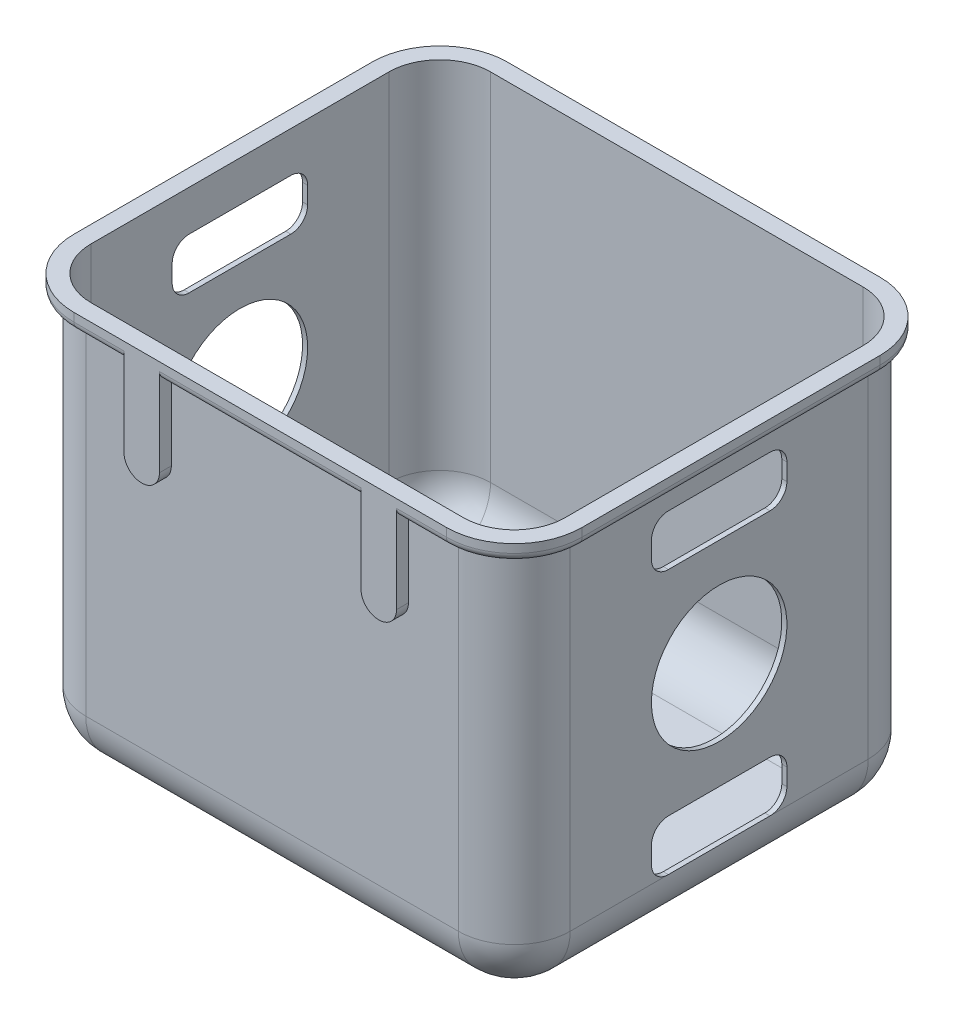
from build123d import *

# Parameters (mm, degrees)
SKETCH1_W           = 286
SKETCH1_H           = 242
BOSS_EXTRUDE1_DEPTH = 243
FILLET1_R           = 33
SHELL1_T            = -3
SKETCH3_R           = 40
CUT_EXTRUDE1_DEPTH  = 398.626829465
BOSS_EXTRUDE2_DEPTH = 10
FILLET2_R           = 5
BOSS_EXTRUDE3_REACH = 386.511
SKETCH7_W           = 40
SKETCH7_H           = 18
BOSS_EXTRUDE5_REACH = 386.511
SKETCH9_R           = 10.5
SKETCH9_W           = 21
SKETCH9_H           = 56.75
SKETCH8_R           = 15
BOSS_EXTRUDE4_DEPTH = 5
FILLET3_R           = 5


with BuildPart() as part:
    # Sketch1 → Boss-Extrude1 (new body)
    with BuildSketch(Plane(origin=(0, 0, 0), x_dir=(1, 0, 0), z_dir=(0, 1, 0))):
        with Locations((-2.523529412, -10.385294118)):
            Rectangle(SKETCH1_W, SKETCH1_H)
    extrude(amount=BOSS_EXTRUDE1_DEPTH)

    # Fillet1
    fillet1_edges = [part.edges().sort_by_distance(p)[0] for p in [
        (-2.523529412, 0, -110.614705882),
        (140.476470588, 0, 10.385294118),
        (-2.523529412, 0, 131.385294118),
        (-145.523529412, 0, 10.385294118),
        (-145.523529412, 121.5, -110.614705882),
        (140.476470588, 121.5, -110.614705882),
        (140.476470588, 121.5, 131.385294118),
        (-145.523529412, 121.5, 131.385294118),
    ]]
    fillet(fillet1_edges, radius=FILLET1_R)

    # Shell1
    shell1_openings = [part.faces().sort_by_distance(p)[0] for p in [
        (-2.523529412, 243, 10.385294118),
    ]]
    offset(amount=SHELL1_T, openings=shell1_openings, kind=Kind.INTERSECTION)

    # Sketch3 → Cut-Extrude1 (cut, through all)
    with BuildSketch(Plane.ZY.offset(145.523529412)):
        with Locations((10.385294118, 126)):
            Circle(SKETCH3_R)
        with BuildLine():
            Line((40.385294118, 219), (-19.614705882, 219))
            ThreePointArc((-19.614705882, 219), (-26.685773694, 216.071067812), (-29.614705882, 209))
            Line((-29.614705882, 209), (-29.614705882, 199))
            ThreePointArc((-29.614705882, 199), (-26.685773694, 191.928932188), (-19.614705882, 189))
            Line((-19.614705882, 189), (40.385294118, 189))
            ThreePointArc((40.385294118, 189), (47.45636193, 191.928932188), (50.385294118, 199))
            Line((50.385294118, 199), (50.385294118, 209))
            ThreePointArc((50.385294118, 209), (47.45636193, 216.071067812), (40.385294118, 219))
        make_face()
        with BuildLine():
            Line((-19.614705882, 63), (40.385294118, 63))
            ThreePointArc((40.385294118, 63), (47.45636193, 60.071067812), (50.385294118, 53))
            Line((50.385294118, 53), (50.385294118, 43))
            ThreePointArc((50.385294118, 43), (47.45636193, 35.928932188), (40.385294118, 33))
            Line((40.385294118, 33), (-19.614705882, 33))
            ThreePointArc((-19.614705882, 33), (-26.685773694, 35.928932188), (-29.614705882, 43))
            Line((-29.614705882, 43), (-29.614705882, 53))
            ThreePointArc((-29.614705882, 53), (-26.685773694, 60.071067812), (-19.614705882, 63))
        make_face()
    extrude(amount=-CUT_EXTRUDE1_DEPTH, mode=Mode.SUBTRACT)

    # Sketch6 → Boss-Extrude2 (add)
    with BuildSketch(Plane(origin=(0, 243, 0), x_dir=(1, 0, 0), z_dir=(0, 1, 0))):
        with BuildLine():
            Line((-112.523529412, 117.614705882), (107.476470588, 117.614705882))
            ThreePointArc((107.476470588, 117.614705882), (135.760741836, 105.89897713), (147.476470588, 77.614705882))
            Line((147.476470588, 77.614705882), (147.476470588, -98.385294118))
            ThreePointArc((147.476470588, -98.385294118), (135.760741836, -126.669565365), (107.476470588, -138.385294118))
            Line((107.476470588, -138.385294118), (-112.523529412, -138.385294118))
            ThreePointArc((-112.523529412, -138.385294118), (-140.807800659, -126.669565365), (-152.523529412, -98.385294118))
            Line((-152.523529412, -98.385294118), (-152.523529412, 77.614705882))
            ThreePointArc((-152.523529412, 77.614705882), (-140.807800659, 105.89897713), (-112.523529412, 117.614705882))
        make_face()
        with BuildLine():
            Line((-112.523529412, 110.614705882), (107.476470588, 110.614705882))
            ThreePointArc((107.476470588, 110.614705882), (130.810994367, 100.949229662), (140.476470588, 77.614705882))
            Line((140.476470588, 77.614705882), (140.476470588, -98.385294118))
            ThreePointArc((140.476470588, -98.385294118), (130.810994367, -121.719817897), (107.476470588, -131.385294118))
            Line((107.476470588, -131.385294118), (-112.523529412, -131.385294118))
            ThreePointArc((-112.523529412, -131.385294118), (-135.858053191, -121.719817897), (-145.523529412, -98.385294118))
            Line((-145.523529412, -98.385294118), (-145.523529412, 77.614705882))
            ThreePointArc((-145.523529412, 77.614705882), (-135.858053191, 100.949229662), (-112.523529412, 110.614705882))
        make_face(mode=Mode.SUBTRACT)
    extrude(amount=-BOSS_EXTRUDE2_DEPTH)

    # Fillet2
    fillet2_edges = [part.edges().sort_by_distance(p)[0] for p in [
        (-140.807800659, 233, 126.669565365),
        (-152.523529412, 233, 10.385294118),
        (-140.807800659, 233, -105.89897713),
        (-2.523529412, 233, -117.614705882),
        (135.760741836, 233, -105.89897713),
        (147.476470588, 233, 10.385294118),
        (135.760741836, 233, 126.669565365),
        (-2.523529412, 233, 138.385294118),
    ]]
    fillet(fillet2_edges, radius=FILLET2_R)

    # Sketch7 → Boss-Extrude3 (add, up to next)
    with BuildSketch(Plane(origin=(0, 0, -117.614705882), x_dir=(-1, 0, 0), z_dir=(0, 0, -1)), mode=Mode.PRIVATE) as boss_extrude3_sk1:
        with Locations((-67.476470588, 234)):
            Rectangle(SKETCH7_W, SKETCH7_H)
    boss_extrude3_tool1 = extrude(boss_extrude3_sk1.sketch, amount=-BOSS_EXTRUDE3_REACH, mode=Mode.PRIVATE) - part.part
    # Sketch7 → Boss-Extrude3 (add, up to next)
    with BuildSketch(Plane(origin=(0, 0, -117.614705882), x_dir=(-1, 0, 0), z_dir=(0, 0, -1)), mode=Mode.PRIVATE) as boss_extrude3_sk2:
        with Locations((72.523529412, 234)):
            Rectangle(SKETCH7_W, SKETCH7_H)
    boss_extrude3_tool2 = extrude(boss_extrude3_sk2.sketch, amount=-BOSS_EXTRUDE3_REACH, mode=Mode.PRIVATE) - part.part
    add(boss_extrude3_tool1.solids().sort_by_distance((67.476471, 234, -117.614706))[0])
    add(boss_extrude3_tool2.solids().sort_by_distance((-72.523529, 234, -117.614706))[0])

    # Sketch9 → Boss-Extrude5 (add, up to next)
    with BuildSketch(Plane.XY.offset(138.385294118), mode=Mode.PRIVATE) as boss_extrude5_sk1:
        with Locations((-72.523529412, 186.25)):
            Circle(SKETCH9_R)
    boss_extrude5_tool1 = extrude(boss_extrude5_sk1.sketch, amount=-BOSS_EXTRUDE5_REACH, mode=Mode.PRIVATE) - part.part
    # Sketch9 → Boss-Extrude5 (add, up to next)
    with BuildSketch(Plane.XY.offset(138.385294118), mode=Mode.PRIVATE) as boss_extrude5_sk2:
        with Locations((67.476470588, 186.25)):
            Circle(SKETCH9_R)
    boss_extrude5_tool2 = extrude(boss_extrude5_sk2.sketch, amount=-BOSS_EXTRUDE5_REACH, mode=Mode.PRIVATE) - part.part
    # Sketch9 → Boss-Extrude5 (add, up to next)
    with BuildSketch(Plane.XY.offset(138.385294118), mode=Mode.PRIVATE) as boss_extrude5_sk3:
        with Locations((-72.523529412, 214.625)):
            Rectangle(SKETCH9_W, SKETCH9_H)
    boss_extrude5_tool3 = extrude(boss_extrude5_sk3.sketch, amount=-BOSS_EXTRUDE5_REACH, mode=Mode.PRIVATE) - part.part
    # Sketch9 → Boss-Extrude5 (add, up to next)
    with BuildSketch(Plane.XY.offset(138.385294118), mode=Mode.PRIVATE) as boss_extrude5_sk4:
        with Locations((67.476470588, 214.625)):
            Rectangle(SKETCH9_W, SKETCH9_H)
    boss_extrude5_tool4 = extrude(boss_extrude5_sk4.sketch, amount=-BOSS_EXTRUDE5_REACH, mode=Mode.PRIVATE) - part.part
    add(boss_extrude5_tool1.solids().sort_by_distance((-72.523529, 186.25, 138.385294))[0])
    add(boss_extrude5_tool2.solids().sort_by_distance((67.476471, 186.25, 138.385294))[0])
    add(boss_extrude5_tool3.solids().sort_by_distance((-72.523529, 214.625, 138.385294))[0])
    add(boss_extrude5_tool4.solids().sort_by_distance((67.476471, 214.625, 138.385294))[0])

    # Sketch8 → Boss-Extrude4 (add)
    with BuildSketch(Plane.XZ):
        with Locations(Location((92.476470588, 83.385294118, 0), (0, 0, 90))):
            Circle(SKETCH8_R)
        with Locations(Location((92.476470588, -62.614705882, 0), (0, 0, 270))):
            Circle(SKETCH8_R)
        with Locations(Location((-97.523529412, 83.385294118, 0), (0, 0, 90))):
            Circle(SKETCH8_R)
        with Locations(Location((-97.523529412, -62.614705882, 0), (0, 0, 270))):
            Circle(SKETCH8_R)
    extrude(amount=BOSS_EXTRUDE4_DEPTH)

    # Fillet3
    fillet3_edges = [part.edges().sort_by_distance(p)[0] for p in [
        (92.476470588, -5, 68.385294118),
        (92.476470588, -5, -47.614705882),
        (-97.523529412, -5, 68.385294118),
        (-97.523529412, -5, -47.614705882),
    ]]
    fillet(fillet3_edges, radius=FILLET3_R - 0.0001)  # a hair under: the kernel refuses the full size


solid = part.part
